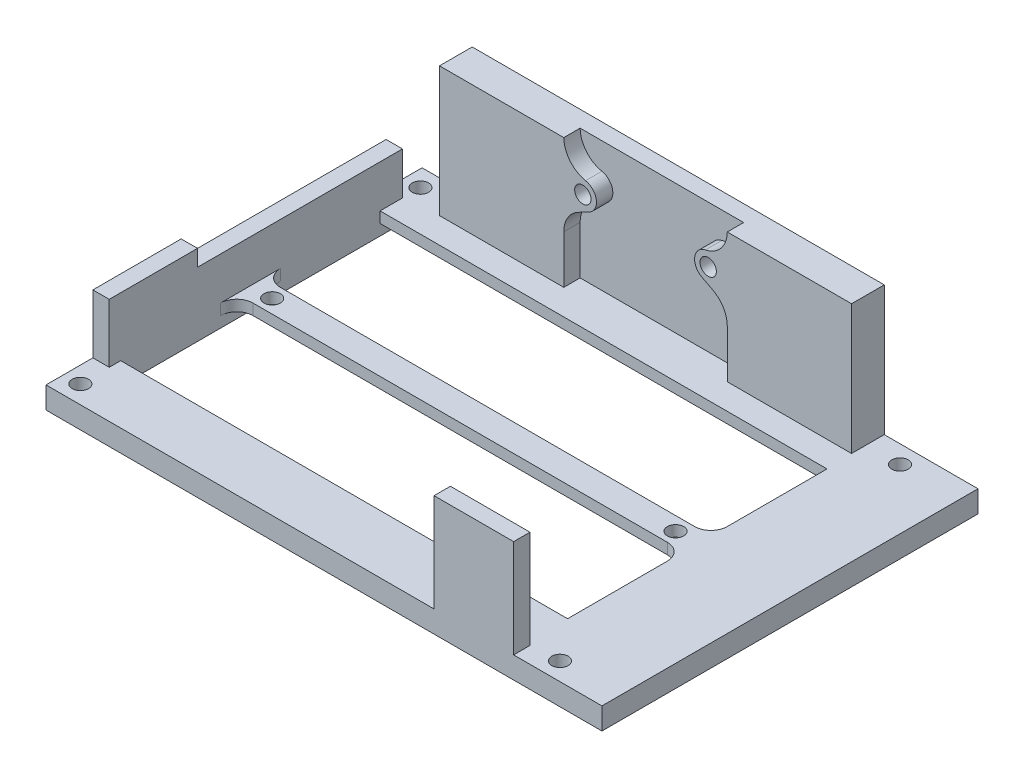
from build123d import *

# Parameters (mm, degrees)
SKETCH1_W           = 102
SKETCH1_H           = 69
SKETCH1_R           = 1.5
SKETCH1_W_2         = 82
SKETCH1_H_2         = 51.6
BOSS_EXTRUDE1_DEPTH = 2
SKETCH2_W           = 102
SKETCH2_H           = 69
SKETCH2_R           = 1.5
SKETCH2_W_2         = 82
SKETCH2_H_2         = 21.3
BOSS_EXTRUDE2_DEPTH = 2
FILLET1_R           = 3
SKETCH3_R           = 1.5
CUT_EXTRUDE1_DEPTH  = 62.605600395
SKETCH9_W           = 75.6
SKETCH9_H           = 6
BOSS_EXTRUDE5_DEPTH = 23.8
SKETCH10_R          = 1.5
CUT_EXTRUDE6_DEPTH  = 3
FILLET3_R           = 5
SKETCH11_W          = 14.6
SKETCH11_H          = 3
BOSS_EXTRUDE6_DEPTH = 18
SKETCH12_W          = 3
SKETCH12_H          = 53.8
BOSS_EXTRUDE7_DEPTH = 7.8
SKETCH13_W          = 3
SKETCH13_H          = 16.2
BOSS_EXTRUDE8_DEPTH = 3


with BuildPart() as part:
    # Sketch1 → Boss-Extrude1 (new body)
    with BuildSketch(Plane(origin=(0, 0, 0), x_dir=(1, 0, 0), z_dir=(0, 1, 0))):
        Rectangle(SKETCH1_W, SKETCH1_H)
        with Locations(Location((-48, 31.2, 0), (0, 0, 270))):
            Circle(SKETCH1_R, mode=Mode.SUBTRACT)
        with Locations(Location((40, 31.2, 0), (0, 0, 270))):
            Circle(SKETCH1_R, mode=Mode.SUBTRACT)
        with Locations(Location((40, -31.2, 0), (0, 0, 270))):
            Circle(SKETCH1_R, mode=Mode.SUBTRACT)
        with Locations(Location((-48, -31.2, 0), (0, 0, 270))):
            Circle(SKETCH1_R, mode=Mode.SUBTRACT)
        with Locations((-7, 0)):
            Rectangle(SKETCH1_W_2, SKETCH1_H_2, mode=Mode.SUBTRACT)
    extrude(amount=BOSS_EXTRUDE1_DEPTH)

    # Sketch2 → Boss-Extrude2 (add)
    with BuildSketch(Plane(origin=(0, 2, 0), x_dir=(1, 0, 0), z_dir=(0, 1, 0))):
        Rectangle(SKETCH2_W, SKETCH2_H)
        with Locations(Location((-44, 0, 0), (0, 0, 270))):
            Circle(SKETCH2_R, mode=Mode.SUBTRACT)
        with Locations(Location((30, 0, 0), (0, 0, 270))):
            Circle(SKETCH2_R, mode=Mode.SUBTRACT)
        with Locations((-7, 13.15)):
            Rectangle(SKETCH2_W_2, SKETCH2_H_2, mode=Mode.SUBTRACT)
        with Locations((-7, -13.15)):
            Rectangle(SKETCH2_W_2, SKETCH2_H_2, mode=Mode.SUBTRACT)
    extrude(amount=BOSS_EXTRUDE2_DEPTH)

    # Fillet1
    fillet1_edges = [part.edges().sort_by_distance(p)[0] for p in [
        (-48, 3, -2.5),
        (34, 3, -2.5),
        (34, 3, 2.5),
        (-48, 3, 2.5),
    ]]
    fillet(fillet1_edges, radius=FILLET1_R)

    # Sketch3 → Cut-Extrude1 (cut, through all)
    with BuildSketch(Plane.XZ.offset(-2)):
        with Locations(Location((-48, 31.2, 0), (0, 0, 270))):
            Circle(SKETCH3_R)
        with Locations(Location((-48, -31.2, 0), (0, 0, 270))):
            Circle(SKETCH3_R)
        with Locations(Location((40, -31.2, 0), (0, 0, 270))):
            Circle(SKETCH3_R)
        with Locations(Location((40, 31.2, 0), (0, 0, 270))):
            Circle(SKETCH3_R)
    extrude(amount=-CUT_EXTRUDE1_DEPTH, mode=Mode.SUBTRACT)

    # Sketch9 → Boss-Extrude5 (add)
    with BuildSketch(Plane(origin=(0, 4, 0), x_dir=(1, 0, 0), z_dir=(0, 1, 0))):
        with Locations((-4, 31.5)):
            Rectangle(SKETCH9_W, SKETCH9_H)
    extrude(amount=BOSS_EXTRUDE5_DEPTH)

    # Sketch10 → Cut-Extrude6 (cut)
    with BuildSketch(Plane.XY.offset(-28.5)):
        with BuildLine():
            Line((11, 27.8), (-19, 27.8))
            Line((-19, 27.8), (-19, 23))
            Line((-19, 23), (-15.5, 23))
            ThreePointArc((-15.5, 23), (-13.069617557, 21.085867885), (-14.360893582, 18.274592943))
            Line((-14.360893582, 18.274592943), (-19, 15.9))
            Line((-19, 15.9), (-19, 4))
            Line((-19, 4), (11, 4))
            Line((11, 4), (11, 15.9))
            Line((11, 15.9), (6.360893582, 18.274592943))
            ThreePointArc((6.360893582, 18.274592943), (5.069617557, 21.085867885), (7.5, 23))
            Line((7.5, 23), (11, 23))
            Line((11, 23), (11, 27.8))
        make_face()
        with Locations((-15.5, 20.5)):
            Circle(SKETCH10_R)
        with Locations((7.5, 20.5)):
            Circle(SKETCH10_R)
    extrude(amount=-CUT_EXTRUDE6_DEPTH, mode=Mode.SUBTRACT)

    # Fillet3
    # the kernel refuses this fillet: 5 mm, written as the material it adds along each edge
    with BuildSketch(Plane(origin=(-19, 15.9, -28.5), x_dir=(0, -1, 0), z_dir=(0, 0, -1))) as fillet3_piece_1:
        with BuildLine():
            CenterArc((FILLET3_R * 0.611525688318, -FILLET3_R), FILLET3_R, 90, 62.893714251)
            Line((-FILLET3_R * 0.278637134463, -FILLET3_R * 0.544357432916), (0, 0))
            Line((0, 0), (FILLET3_R * 0.611525688318, 0))
        make_face()
    extrude(amount=3)
    with BuildSketch(Plane(origin=(11, 15.9, -28.5), x_dir=(0, -1, 0), z_dir=(0, 0, -1))) as fillet3_piece_2:
        with BuildLine():
            CenterArc((FILLET3_R * 0.611525688318, FILLET3_R), FILLET3_R, 207.106285749, 62.893714251)
            Line((-FILLET3_R * 0.278637134463, FILLET3_R * 0.544357432916), (0, 0))
            Line((0, 0), (FILLET3_R * 0.611525688318, 0))
        make_face()
    extrude(amount=3)
    with BuildSketch(Plane(origin=(11, 23, -28.5), x_dir=(-0.9999202818433616, -0.012626557658055267, 0), z_dir=(0, 0, -1))) as fillet3_piece_3_section:
        with BuildLine():
            CenterArc((4.938381933, 4.911215506), FILLET3_R, 180.723467688, 78.463040967)
            Line((-0.061219476, 4.848082717), (-0.561179617, 4.841769438))
            Line((-0.561179617, 4.841769438), (-0.499960141, -0.006313279))
            Line((-0.499960141, -0.006313279), (0.006313279, -0.499960141))
            ThreePointArc((0.006313279, -0.499960141), (3.506034265, -0.455767189), (3.906512595, -0.491121551))
            Line((3.906512595, -0.491121551), (4.000318898, 0))
        make_face()
    fillet3_piece_3 = extrude(amount=3, mode=Mode.PRIVATE)
    fillet3_piece_3 = split(fillet3_piece_3, bisect_by=Plane(origin=(10.155931767, 27.8, -30), z_dir=(0, -1, 0)), keep=Keep.TOP, mode=Mode.PRIVATE)
    add(fillet3_piece_3)
    with BuildSketch(Plane(origin=(-19, 23, -28.5), x_dir=(0, 1, 0), z_dir=(0, 0, -1))) as fillet3_piece_4_section:
        with BuildLine():
            CenterArc((4.848469228, 5), FILLET3_R, 191.536959033, 78.463040967)
            Line((-0.050510257, 4), (-0.540408206, 3.9))
            ThreePointArc((-0.540408206, 3.9), (-0.5, 3.5), (-0.5, 0))
            Line((-0.5, 0), (0, -0.5))
            Line((0, -0.5), (4.848469228, -0.5))
            Line((4.848469228, -0.5), (4.848469228, 0))
        make_face()
    fillet3_piece_4 = extrude(amount=3, mode=Mode.PRIVATE)
    fillet3_piece_4 = split(fillet3_piece_4, bisect_by=Plane(origin=(-18.155931767, 27.8, -30), z_dir=(0, -1, 0)), keep=Keep.TOP, mode=Mode.PRIVATE)
    add(fillet3_piece_4)

    # Sketch11 → Boss-Extrude6 (add)
    with BuildSketch(Plane(origin=(0, 4, 0), x_dir=(1, 0, 0), z_dir=(0, 1, 0))):
        with Locations((27.5, -33)):
            Rectangle(SKETCH11_W, SKETCH11_H)
    extrude(amount=BOSS_EXTRUDE6_DEPTH)

    # Sketch12 → Boss-Extrude7 (add)
    with BuildSketch(Plane(origin=(0, 4, 0), x_dir=(1, 0, 0), z_dir=(0, 1, 0))):
        with Locations((-49.5, 1)):
            Rectangle(SKETCH12_W, SKETCH12_H)
    extrude(amount=BOSS_EXTRUDE7_DEPTH)

    # Sketch13 → Boss-Extrude8 (add)
    with BuildSketch(Plane(origin=(0, 11.8, 0), x_dir=(1, 0, 0), z_dir=(0, 1, 0))):
        with Locations((-49.5, -17.8)):
            Rectangle(SKETCH13_W, SKETCH13_H)
    extrude(amount=BOSS_EXTRUDE8_DEPTH)


solid = part.part
